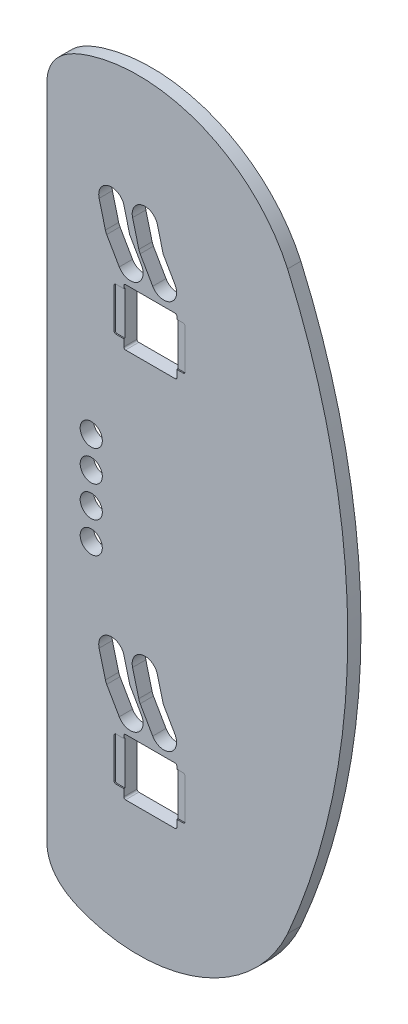
from build123d import *

# Parameters (mm, degrees)
SKETCH19_R          = 15.875
BOSS_EXTRUDE2_DEPTH = 19.05
BOSS_EXTRUDE3_DEPTH = 17.4625


with BuildPart() as part:
    # Sketch19 → Boss-Extrude2 (new body)
    with BuildSketch(Plane.XY):
        with BuildLine():
            add(Edge.make_bspline(
                [(1361.096561672, 1948.863494174), (1364.400827848, 1984.023171072), (1498.613211066, 2056.462277252), (1658.30760281, 1990.654880293), (1706.236065024, 1885.549246122)],
                knots=[0, 0, 0, 0, 0.219674411, 1, 1, 1, 1], degree=3))
            Line((1361.096561672, 1948.863494174), (1361.096561672, 996.363494176))
            add(Edge.make_bspline(
                [(1361.096561672, 996.363494176), (1364.400827848, 961.203817278), (1498.613211066, 888.764711097), (1658.30760281, 954.572108057), (1706.236065024, 1059.677742228)],
                knots=[0, 0, 0, 0, 0.219674411, 1, 1, 1, 1], degree=3))
            ThreePointArc((1706.236065024, 1059.677742228), (1792.519416012, 1472.613494175), (1706.236065024, 1885.549246122))
        make_face()
        with BuildLine():
            Line((1556.504865632, 1122.44241392), (1547.43077252, 1122.44241392))
            Line((1547.43077252, 1122.44241392), (1547.43077252, 1112.28241392))
            ThreePointArc((1547.43077252, 1112.28241392), (1546.686823744, 1110.486362696), (1544.89077252, 1109.74241392))
            Line((1544.89077252, 1109.74241392), (1473.77077252, 1109.74241392))
            ThreePointArc((1473.77077252, 1109.74241392), (1471.974721296, 1110.486362696), (1471.23077252, 1112.28241392))
            Line((1471.23077252, 1112.28241392), (1471.23077252, 1122.44241392))
            Line((1471.23077252, 1122.44241392), (1459.984865632, 1122.44241392))
            ThreePointArc((1459.984865632, 1122.44241392), (1458.188814408, 1123.186362696), (1457.444865632, 1124.98241392))
            Line((1457.444865632, 1124.98241392), (1457.444865632, 1182.13241392))
            ThreePointArc((1457.444865632, 1182.13241392), (1458.188814408, 1183.928465145), (1459.984865632, 1184.67241392))
            Line((1459.984865632, 1184.67241392), (1471.23077252, 1184.67241392))
            Line((1471.23077252, 1184.67241392), (1471.23077252, 1188.48241392))
            ThreePointArc((1471.23077252, 1188.48241392), (1471.974721296, 1190.278465145), (1473.77077252, 1191.02241392))
            Line((1473.77077252, 1191.02241392), (1544.89077252, 1191.02241392))
            ThreePointArc((1544.89077252, 1191.02241392), (1546.686823744, 1190.278465145), (1547.43077252, 1188.48241392))
            Line((1547.43077252, 1188.48241392), (1547.43077252, 1184.67241392))
            Line((1547.43077252, 1184.67241392), (1556.504865632, 1184.67241392))
            ThreePointArc((1556.504865632, 1184.67241392), (1558.300916856, 1183.928465145), (1559.044865632, 1182.13241392))
            Line((1559.044865632, 1182.13241392), (1559.044865632, 1124.98241392))
            ThreePointArc((1559.044865632, 1124.98241392), (1558.300916856, 1123.186362696), (1556.504865632, 1122.44241392))
        make_face(mode=Mode.SUBTRACT)
        with BuildLine():
            Line((1444.893065071, 1244.244623225), (1435.893057671, 1279.244553225))
            ThreePointArc((1435.893057671, 1279.244553225), (1449.094985702, 1301.58631231), (1471.436744787, 1288.384384279))
            Line((1471.436744787, 1288.384384279), (1479.734522372, 1256.115340295))
            ThreePointArc((1479.734522372, 1256.115340295), (1479.841246759, 1255.791962976), (1479.990269115, 1255.485768066))
            Line((1479.990269115, 1255.485768066), (1495.595800102, 1228.231937145))
            ThreePointArc((1495.595800102, 1228.231937145), (1496.589194493, 1226.682766417), (1497.422422708, 1225.041884612))
            ThreePointArc((1497.422422708, 1225.041884612), (1488.994111708, 1201.213784587), (1464.764130707, 1208.40564094))
            Line((1464.764130707, 1208.40564094), (1446.764069078, 1239.655616711))
            ThreePointArc((1446.764069078, 1239.655616711), (1445.672935755, 1241.886666839), (1444.893065071, 1244.244623225))
        make_face(mode=Mode.SUBTRACT)
        with Locations((1424.596561672, 1405.938494174)):
            Circle(SKETCH19_R, mode=Mode.SUBTRACT)
        with Locations((1424.596561672, 1450.388494174)):
            Circle(SKETCH19_R, mode=Mode.SUBTRACT)
        with BuildLine():
            Line((1527.986726026, 1255.506514787), (1544.56575997, 1226.723451874))
            ThreePointArc((1544.56575997, 1226.723451874), (1537.823790218, 1201.663704337), (1512.764042681, 1208.405674089))
            Line((1512.764042681, 1208.405674089), (1494.764045881, 1239.655687936))
            ThreePointArc((1494.764045881, 1239.655687936), (1493.802589185, 1241.576837352), (1493.072252129, 1243.597189262))
            ThreePointArc((1493.072252129, 1243.597189262), (1492.894588833, 1244.238723731), (1492.740311476, 1244.886280075))
            Line((1492.740311476, 1244.886280075), (1483.894581433, 1279.238653731))
            ThreePointArc((1483.894581433, 1279.238653731), (1497.09201275, 1301.585586702), (1519.436740684, 1288.384422355))
            Line((1519.436740684, 1288.384422355), (1527.727745028, 1256.141718681))
            ThreePointArc((1527.727745028, 1256.141718681), (1527.835693423, 1255.815333734), (1527.986726026, 1255.506514787))
        make_face(mode=Mode.SUBTRACT)
        with Locations((1424.596561672, 1494.838494174)):
            Circle(SKETCH19_R, mode=Mode.SUBTRACT)
        with Locations((1424.596561672, 1539.288494174)):
            Circle(SKETCH19_R, mode=Mode.SUBTRACT)
        with BuildLine():
            Line((1547.43077252, 1681.24241392), (1547.43077252, 1671.08241392))
            ThreePointArc((1547.43077252, 1671.08241392), (1546.686823744, 1669.286362696), (1544.89077252, 1668.54241392))
            Line((1544.89077252, 1668.54241392), (1473.77077252, 1668.54241392))
            ThreePointArc((1473.77077252, 1668.54241392), (1471.974721296, 1669.286362696), (1471.23077252, 1671.08241392))
            Line((1471.23077252, 1671.08241392), (1471.23077252, 1681.24241392))
            Line((1471.23077252, 1681.24241392), (1459.984865632, 1681.24241392))
            ThreePointArc((1459.984865632, 1681.24241392), (1458.188814408, 1681.986362696), (1457.444865632, 1683.78241392))
            Line((1457.444865632, 1683.78241392), (1457.444865632, 1740.93241392))
            ThreePointArc((1457.444865632, 1740.93241392), (1458.188814408, 1742.728465145), (1459.984865632, 1743.47241392))
            Line((1459.984865632, 1743.47241392), (1471.23077252, 1743.47241392))
            Line((1471.23077252, 1743.47241392), (1471.23077252, 1747.28241392))
            ThreePointArc((1471.23077252, 1747.28241392), (1471.974721296, 1749.078465145), (1473.77077252, 1749.82241392))
            Line((1473.77077252, 1749.82241392), (1544.89077252, 1749.82241392))
            ThreePointArc((1544.89077252, 1749.82241392), (1546.686823744, 1749.078465145), (1547.43077252, 1747.28241392))
            Line((1547.43077252, 1747.28241392), (1547.43077252, 1743.47241392))
            Line((1547.43077252, 1743.47241392), (1556.504865632, 1743.47241392))
            ThreePointArc((1556.504865632, 1743.47241392), (1558.300916856, 1742.728465145), (1559.044865632, 1740.93241392))
            Line((1559.044865632, 1740.93241392), (1559.044865632, 1683.78241392))
            ThreePointArc((1559.044865632, 1683.78241392), (1558.300916856, 1681.986362696), (1556.504865632, 1681.24241392))
            Line((1556.504865632, 1681.24241392), (1547.43077252, 1681.24241392))
        make_face(mode=Mode.SUBTRACT)
        with BuildLine():
            Line((1444.893131568, 1803.044661302), (1435.893124168, 1838.044591302))
            ThreePointArc((1435.893124168, 1838.044591302), (1449.095052199, 1860.386350386), (1471.436811284, 1847.184422355))
            Line((1471.436811284, 1847.184422355), (1479.727821657, 1814.941695236))
            ThreePointArc((1479.727821657, 1814.941695236), (1479.835768961, 1814.615312965), (1479.98679977, 1814.30649635))
            Line((1479.98679977, 1814.30649635), (1496.565772911, 1785.52338757))
            ThreePointArc((1496.565772911, 1785.52338757), (1489.823779303, 1760.463721825), (1464.764105889, 1767.205686923))
            Line((1464.764105889, 1767.205686923), (1446.764116481, 1798.455687936))
            ThreePointArc((1446.764116481, 1798.455687936), (1445.672995031, 1800.686722627), (1444.893131568, 1803.044661302))
        make_face(mode=Mode.SUBTRACT)
        with BuildLine():
            Line((1492.893060968, 1803.044661302), (1483.893053568, 1838.044591302))
            ThreePointArc((1483.893053568, 1838.044591302), (1497.094981599, 1860.386350386), (1519.436740684, 1847.184422355))
            Line((1519.436740684, 1847.184422355), (1527.727745028, 1814.941718681))
            ThreePointArc((1527.727745028, 1814.941718681), (1527.835693423, 1814.615333734), (1527.986726026, 1814.306514787))
            Line((1527.986726026, 1814.306514787), (1544.56575257, 1785.523464721))
            ThreePointArc((1544.56575257, 1785.523464721), (1537.823782818, 1760.463717184), (1512.764035281, 1767.205686936))
            Line((1512.764035281, 1767.205686936), (1494.764045881, 1798.455687936))
            ThreePointArc((1494.764045881, 1798.455687936), (1493.672924431, 1800.686722627), (1492.893060968, 1803.044661302))
        make_face(mode=Mode.SUBTRACT)
    extrude(amount=BOSS_EXTRUDE2_DEPTH)

    # Sketch17 → Boss-Extrude3 (add)
    with BuildSketch(Plane.XY):
        with BuildLine():
            Line((1471.23077252, 1681.24241392), (1471.23077252, 1743.47241392))
            Line((1471.23077252, 1743.47241392), (1459.984865632, 1743.47241392))
            ThreePointArc((1459.984865632, 1743.47241392), (1458.188814408, 1742.728465145), (1457.444865632, 1740.93241392))
            Line((1457.444865632, 1740.93241392), (1457.444865632, 1683.78241392))
            ThreePointArc((1457.444865632, 1683.78241392), (1458.188814408, 1681.986362696), (1459.984865632, 1681.24241392))
            Line((1459.984865632, 1681.24241392), (1471.23077252, 1681.24241392))
        make_face()
        with BuildLine():
            Line((1556.504865632, 1743.47241392), (1547.43077252, 1743.47241392))
            Line((1547.43077252, 1743.47241392), (1547.43077252, 1681.24241392))
            Line((1547.43077252, 1681.24241392), (1556.504865632, 1681.24241392))
            ThreePointArc((1556.504865632, 1681.24241392), (1558.300916856, 1681.986362696), (1559.044865632, 1683.78241392))
            Line((1559.044865632, 1683.78241392), (1559.044865632, 1740.93241392))
            ThreePointArc((1559.044865632, 1740.93241392), (1558.300916856, 1742.728465145), (1556.504865632, 1743.47241392))
        make_face()
        with BuildLine():
            Line((1547.43077252, 1184.67241392), (1547.43077252, 1122.44241392))
            Line((1547.43077252, 1122.44241392), (1556.504865632, 1122.44241392))
            ThreePointArc((1556.504865632, 1122.44241392), (1558.300916856, 1123.186362696), (1559.044865632, 1124.98241392))
            Line((1559.044865632, 1124.98241392), (1559.044865632, 1182.13241392))
            ThreePointArc((1559.044865632, 1182.13241392), (1558.300916856, 1183.928465145), (1556.504865632, 1184.67241392))
            Line((1556.504865632, 1184.67241392), (1547.43077252, 1184.67241392))
        make_face()
        with BuildLine():
            Line((1459.984865632, 1122.44241392), (1471.23077252, 1122.44241392))
            Line((1471.23077252, 1122.44241392), (1471.23077252, 1184.67241392))
            Line((1471.23077252, 1184.67241392), (1459.984865632, 1184.67241392))
            ThreePointArc((1459.984865632, 1184.67241392), (1458.188814408, 1183.928465145), (1457.444865632, 1182.13241392))
            Line((1457.444865632, 1182.13241392), (1457.444865632, 1124.98241392))
            ThreePointArc((1457.444865632, 1124.98241392), (1458.188814408, 1123.186362696), (1459.984865632, 1122.44241392))
        make_face()
    extrude(amount=BOSS_EXTRUDE3_DEPTH)


solid = part.part
